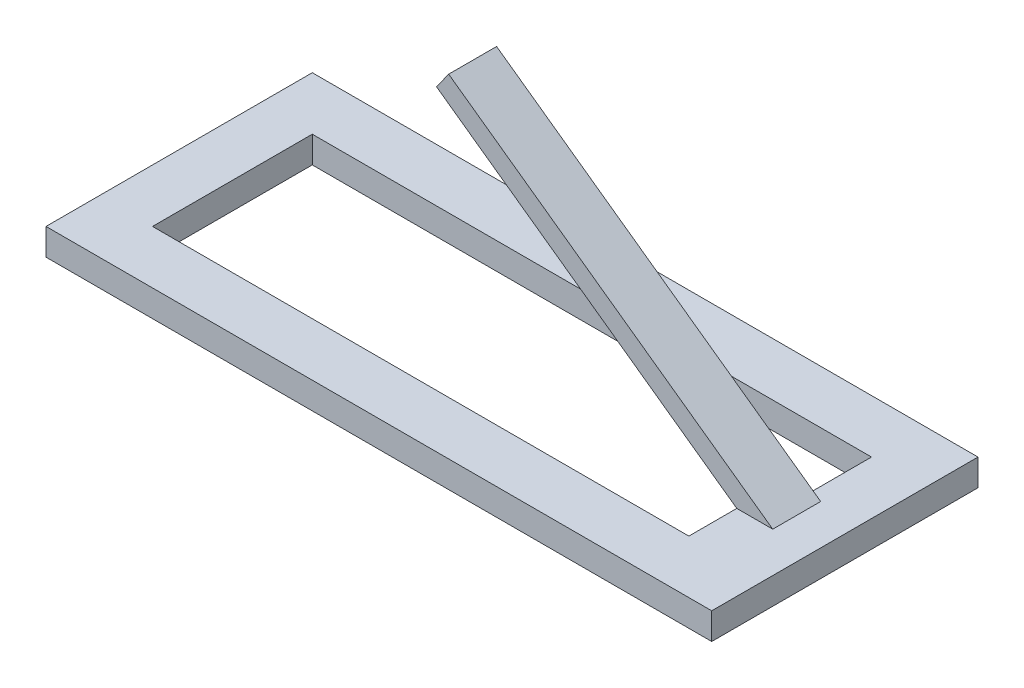
from build123d import *

# Parameters (mm, degrees)
SKETCH1_W           = 250
SKETCH1_H           = 100
SKETCH1_W_2         = 210
SKETCH1_H_2         = 60
BOSS_EXTRUDE2_DEPTH = 10
BOSS_EXTRUDE3_DEPTH = 36
SKETCH3_W           = 140
SKETCH3_H           = 140
CUT_EXTRUDE1_DEPTH  = 18


with BuildPart() as part:
    # Sketch1 → Boss-Extrude2 (new body)
    with BuildSketch(Plane(origin=(0, 0, 0), x_dir=(1, 0, 0), z_dir=(0, 1, 0))):
        with Locations((41.222222222, 30)):
            Rectangle(SKETCH1_W, SKETCH1_H)
        with Locations((41.222222222, 30)):
            Rectangle(SKETCH1_W_2, SKETCH1_H_2, mode=Mode.SUBTRACT)
    extrude(amount=BOSS_EXTRUDE2_DEPTH)

    # Sketch2 → Boss-Extrude3 (add)
    with BuildSketch(Plane.XY):
        Polygon((161.940463141, 2.266232377), (29.446457006, 97.13865195), (24.869662654, 90.746933242), (148.437318839, 2.266232377), align=None)
    extrude(amount=-BOSS_EXTRUDE3_DEPTH)

    # Sketch3 → Cut-Extrude1 (cut)
    with BuildSketch(Plane.XY):
        with Locations((82.194738609, 80)):
            Rectangle(SKETCH3_W, SKETCH3_H)
    extrude(amount=-CUT_EXTRUDE1_DEPTH, mode=Mode.SUBTRACT)


solid = part.part
